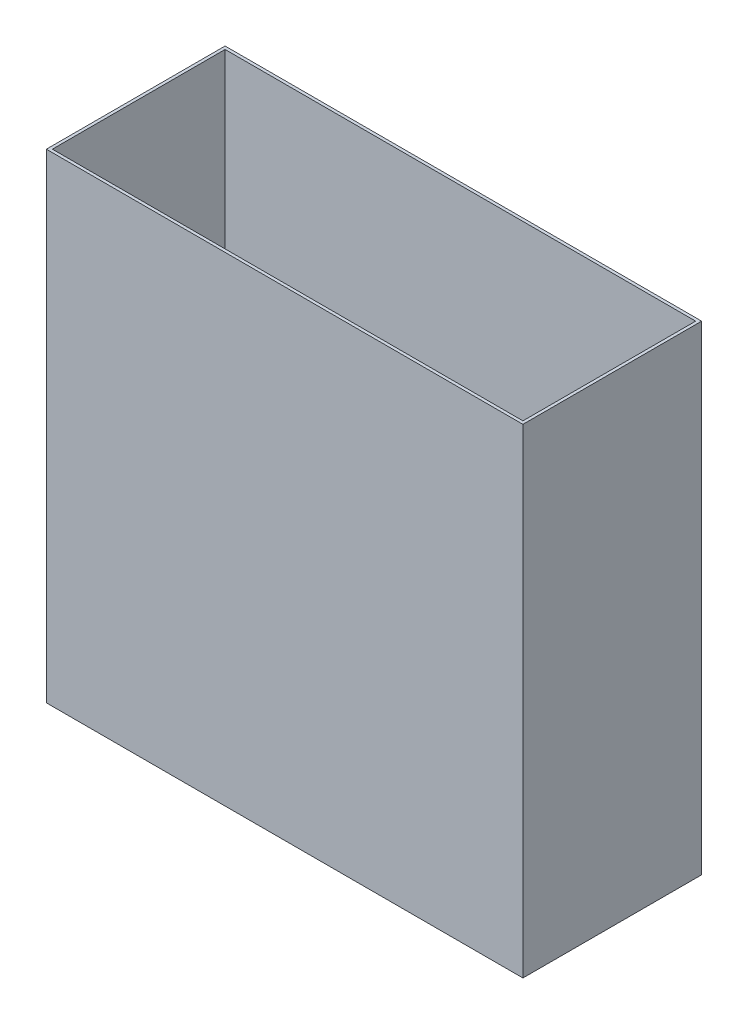
from build123d import *

# Parameters (mm, degrees)
SKETCH1_W           = 406.4
SKETCH1_H           = 152.4
SKETCH1_W_2         = 401.32
SKETCH1_H_2         = 147.32
BOSS_EXTRUDE1_DEPTH = 406.4
SKETCH2_W           = 406.4
SKETCH2_H           = 152.4
BOSS_EXTRUDE2_DEPTH = 2.54


with BuildPart() as part:
    # Sketch1 → Boss-Extrude1 (new body)
    with BuildSketch(Plane(origin=(0, 0, 0), x_dir=(1, 0, 0), z_dir=(0, 1, 0))):
        Rectangle(SKETCH1_W, SKETCH1_H)
        Rectangle(SKETCH1_W_2, SKETCH1_H_2, mode=Mode.SUBTRACT)
    extrude(amount=BOSS_EXTRUDE1_DEPTH)

    # Sketch2 → Boss-Extrude2 (add)
    with BuildSketch(Plane.XZ):
        Rectangle(SKETCH2_W, SKETCH2_H)
    extrude(amount=BOSS_EXTRUDE2_DEPTH)


solid = part.part
